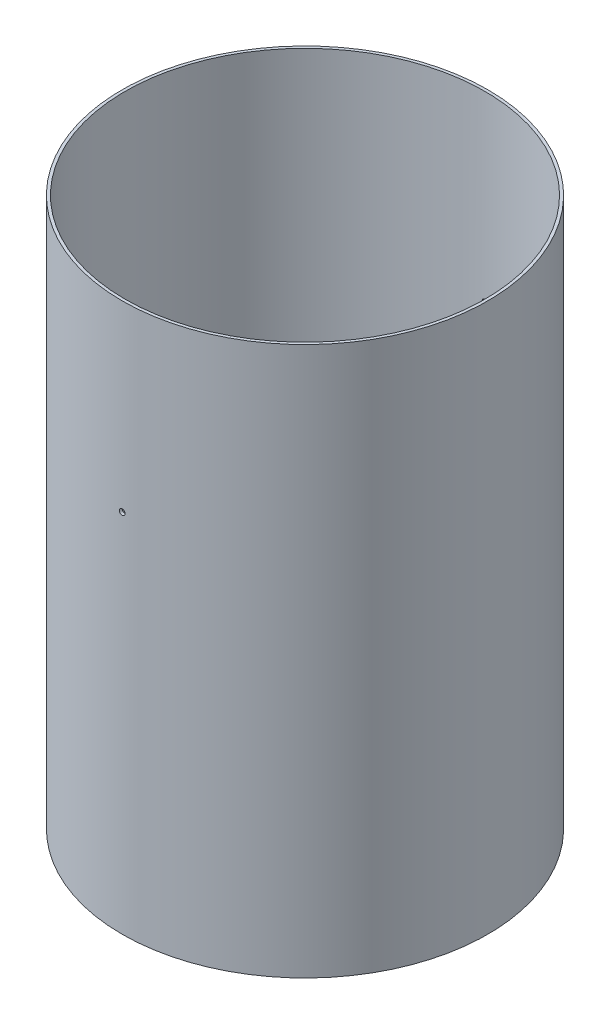
from build123d import *

# Parameters (mm, degrees)
SKETCH1_R               = 101.6
SKETCH1_R_2             = 100.0125
BOSS_EXTRUDE1_DEPTH     = 304.8
CUT_EXTRUDE1_DEPTH      = 381.152390496
CUT_EXTRUDE1_DEPTH_BACK = 381.152390496
SKETCH10_R              = 1.5875


with BuildPart() as part:
    # Sketch1 → Boss-Extrude1 (new body)
    with BuildSketch(Plane(origin=(0, 0, 0), x_dir=(1, 0, 0), z_dir=(0, 1, 0))):
        Circle(SKETCH1_R)
        Circle(SKETCH1_R_2, mode=Mode.SUBTRACT)
    extrude(amount=BOSS_EXTRUDE1_DEPTH)

    # Sketch10 → Cut-Extrude1 (cut, two sides: drawn at the far end of the back side and taken through both)
    with BuildSketch(Plane.XY.offset(101.6).offset(-CUT_EXTRUDE1_DEPTH_BACK)):
        with Locations((0, 203.2)):
            Circle(SKETCH10_R)
    extrude(amount=CUT_EXTRUDE1_DEPTH + CUT_EXTRUDE1_DEPTH_BACK, mode=Mode.SUBTRACT)


solid = part.part
